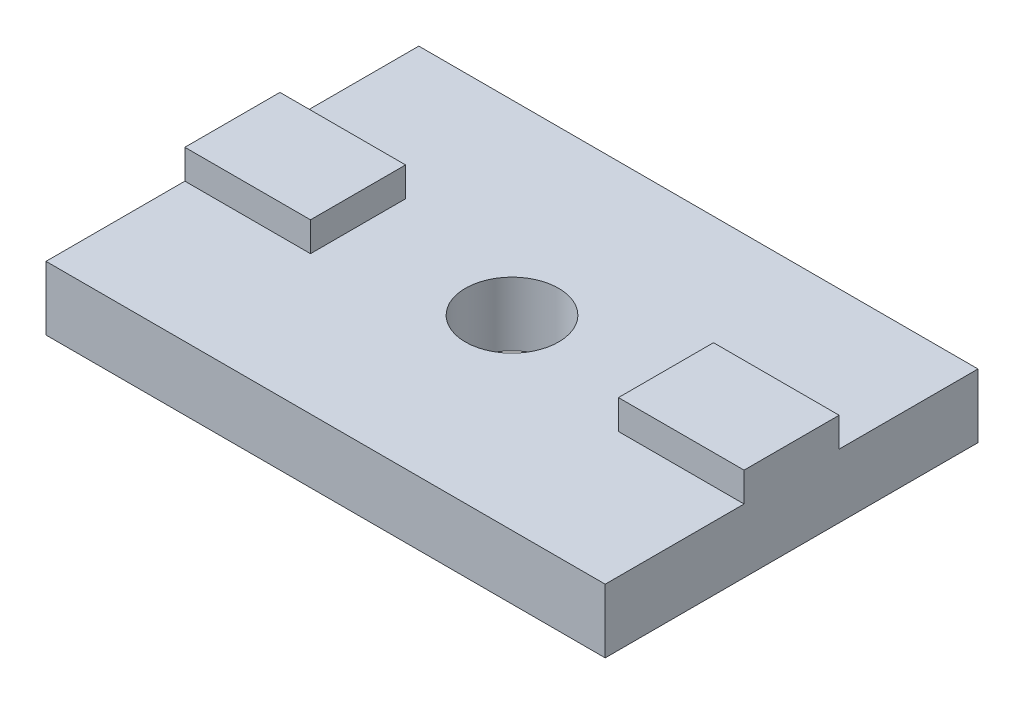
from build123d import *

# Parameters (mm, degrees)
SKETCH1_W           = 38.1
SKETCH1_H           = 25.4
SKETCH1_R           = 3.175
BOSS_EXTRUDE1_DEPTH = 4.35
SKETCH2_W           = 8.5598
SKETCH2_H           = 6.476913764
BOSS_EXTRUDE2_DEPTH = 2


with BuildPart() as part:
    # Sketch1 → Boss-Extrude1 (new body)
    with BuildSketch(Plane(origin=(0, 0, 0), x_dir=(1, 0, 0), z_dir=(0, 1, 0))):
        with Locations((16.172116278, 18.931628639)):
            Rectangle(SKETCH1_W, SKETCH1_H)
        with Locations((16.172116278, 18.931628639)):
            Circle(SKETCH1_R, mode=Mode.SUBTRACT)
    extrude(amount=BOSS_EXTRUDE1_DEPTH)

    # Sketch2 → Boss-Extrude2 (add)
    with BuildSketch(Plane(origin=(0, 4.35, 0), x_dir=(1, 0, 0), z_dir=(0, 1, 0))):
        with Locations((1.402016278, 18.931628639)):
            Rectangle(SKETCH2_W, SKETCH2_H)
        with Locations((30.942216278, 18.931628639)):
            Rectangle(SKETCH2_W, SKETCH2_H)
    extrude(amount=BOSS_EXTRUDE2_DEPTH)


solid = part.part
